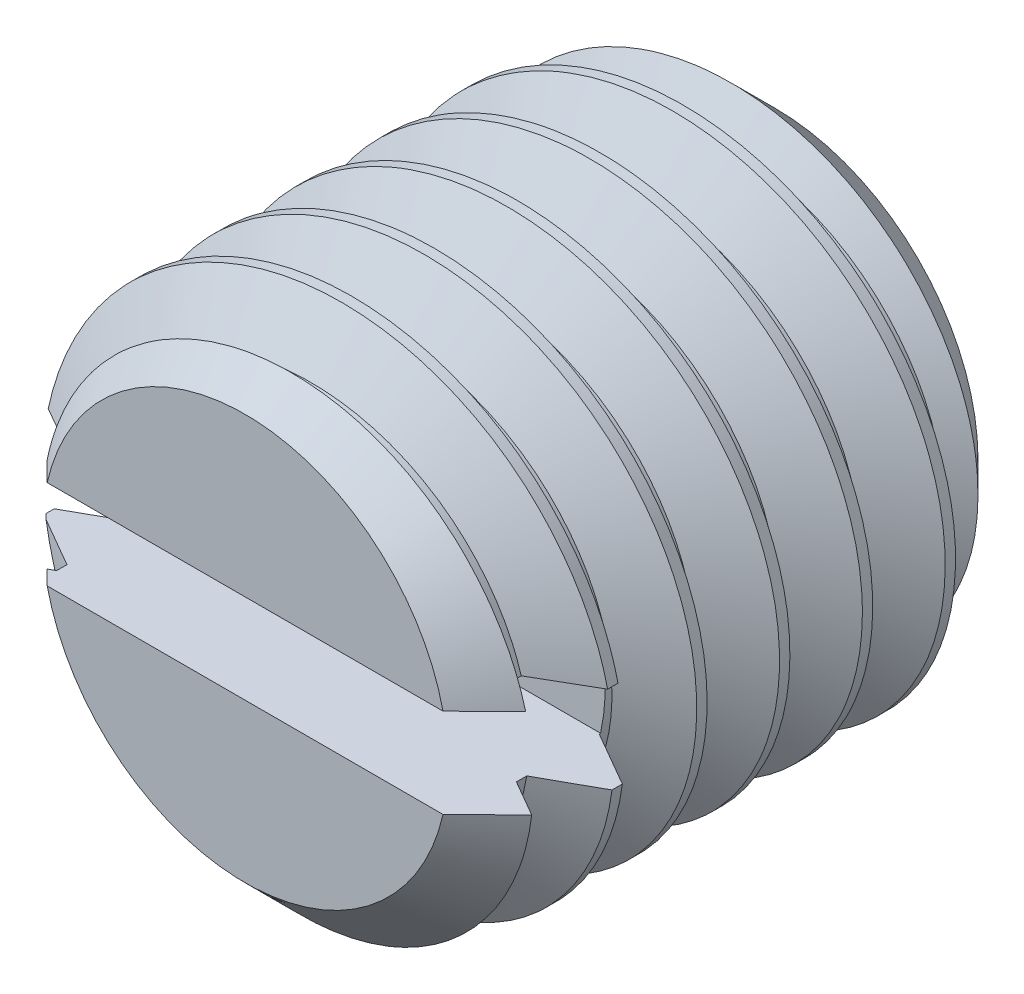
from build123d import *

# Parameters (mm, degrees)
CUT_EXTRUDE1_DEPTH      = 7.92820323
CUT_EXTRUDE1_DEPTH_BACK = 7.92820323
SKETCH3_W               = 2.25
SKETCH3_H               = 1.35
CUT_SWEEP1_PITCH        = 1.25


with BuildPart() as part:
    # Sketch2 → Revolve1 (revolve)
    with BuildSketch(Plane(origin=(0, 0, 0), x_dir=(0, 0, -1), z_dir=(1, 0, 0))):
        Polygon((-4, 0), (-4, 3.0625), (-3.0625, 4), (3.0625, 4), (4, 3.0625), (4, 0), align=None)
    revolve(axis=Axis((0, 0, -4), (0, 0, 1)))

    # Sketch3 → Cut-Extrude1 (cut, two sides: drawn at the far end of the back side and taken through both)
    with BuildSketch(Plane(origin=(0, 0, 0), x_dir=(0, 0, -1), z_dir=(1, 0, 0)).offset(-CUT_EXTRUDE1_DEPTH_BACK)):
        with Locations((-2.875, 0)):
            Rectangle(SKETCH3_W, SKETCH3_H)
    extrude(amount=CUT_EXTRUDE1_DEPTH + CUT_EXTRUDE1_DEPTH_BACK, mode=Mode.SUBTRACT)

    # Cut-Sweep1: the profile of Sketch5 screwed along a right-hand helix of 7.4 turns, 8 arcs to a turn; built about Z, then put on its axis
    cut_sweep1_z = Axis((0, 0, 0), (0, 0, 1))
    cut_sweep1_corners = [(4.067658235, 0, -1.1328125), (4.067658235, 0, 0.0390625), (3.188101184, 0, -0.46875), (3.188101184, 0, -0.625)]
    with BuildLine(mode=Mode.PRIVATE) as cut_sweep1_profile:
        Line(cut_sweep1_corners[0], cut_sweep1_corners[1])
        Line(cut_sweep1_corners[1], cut_sweep1_corners[2])
        Line(cut_sweep1_corners[2], cut_sweep1_corners[3])
        Line(cut_sweep1_corners[3], cut_sweep1_corners[0])
    cut_sweep1_cap = Face(cut_sweep1_profile.wire())
    cut_sweep1_turn_angles = [0, 22.5, 45, 67.5, 90, 112.5, 135, 157.5, 180, 202.5, 225, 247.5, 270, 292.5, 315, 337.5, 360]
    cut_sweep1_turn_weights = [1, 0.9238795325112867, 1, 0.9238795325112867, 1, 0.9238795325112867, 1, 0.9238795325112867, 1, 0.9238795325112867, 1, 0.9238795325112867, 1, 0.9238795325112867, 1, 0.9238795325112867, 1]
    cut_sweep1_turn_rails = [Edge.make_bspline([Vector(p[0], p[1], 0).rotate(cut_sweep1_z, cut_sweep1_turn_angles[k]) / cut_sweep1_turn_weights[k] + Vector(0, 0, p[2] + CUT_SWEEP1_PITCH * cut_sweep1_turn_angles[k] / 360) for k in range(17)], [0, 0, 0, 1, 1, 2, 2, 3, 3, 4, 4, 5, 5, 6, 6, 7, 7, 8, 8, 8], 2, cut_sweep1_turn_weights) for p in cut_sweep1_corners]
    cut_sweep1_turn_sides = [Face.make_surface_from_curves(cut_sweep1_turn_rails[p[0]], cut_sweep1_turn_rails[p[1]]) for p in [(0, 1), (1, 2), (2, 3), (3, 0)]]
    cut_sweep1_last_angles = [2520, 2542.5, 2565, 2587.5, 2610, 2632.5, 2655, 2659.5, 2664]
    cut_sweep1_last_weights = [1, 0.9238795325112867, 1, 0.9238795325112867, 1, 0.9238795325112867, 1, 0.9969173337331242, 1]
    cut_sweep1_last_rails = [Edge.make_bspline([Vector(p[0], p[1], 0).rotate(cut_sweep1_z, cut_sweep1_last_angles[k]) / cut_sweep1_last_weights[k] + Vector(0, 0, p[2] + CUT_SWEEP1_PITCH * cut_sweep1_last_angles[k] / 360) for k in range(9)], [0, 0, 0, 1, 1, 2, 2, 3, 3, 4, 4, 4], 2, cut_sweep1_last_weights) for p in cut_sweep1_corners]
    cut_sweep1_last_sides = [Face.make_surface_from_curves(cut_sweep1_last_rails[p[0]], cut_sweep1_last_rails[p[1]]) for p in [(0, 1), (1, 2), (2, 3), (3, 0)]]
    cut_sweep1 = Plane(origin=(0, 0, 4), x_dir=(0, 1, 0), z_dir=(0, 0, -1)) * Solid(Shell([*[p.moved(Location((0, 0, CUT_SWEEP1_PITCH * i))) for i in range(7) for p in cut_sweep1_turn_sides], *cut_sweep1_last_sides, cut_sweep1_cap, cut_sweep1_cap.rotate(cut_sweep1_z, 2664).moved(Location((0, 0, CUT_SWEEP1_PITCH * 2664 / 360)))]))
    add(cut_sweep1, mode=Mode.SUBTRACT)


solid = part.part
